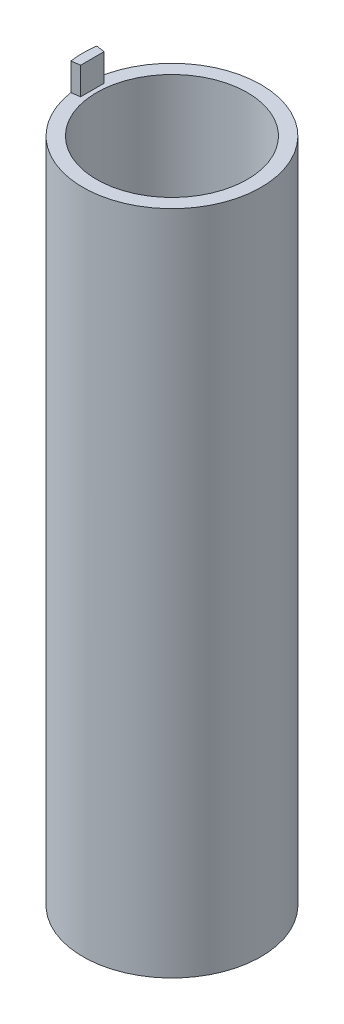
from build123d import *
from build123d.topology import SkipClean

# Parameters (mm, degrees)
SKETCH1_R                = 20.6375
SKETCH1_R_2              = 17.4625
BOSS_EXTRUDE1_DEPTH      = 152.4
BOSS_EXTRUDE2_START      = 2
SKETCH2_R                = 20.6375
BOSS_EXTRUDE2_DEPTH      = 2
SKETCH3_W                = 2
SKETCH3_H                = 6.35
BOSS_EXTRUDE3_REACH      = 166.786
BOSS_EXTRUDE3_END_RADIUS = 18.6375
SKETCH9_W                = 5.421818182
SKETCH9_H                = 6.35


with BuildPart() as part:
    # Sketch1 → Boss-Extrude1 (new body)
    with BuildSketch(Plane(origin=(0, 0, 0), x_dir=(1, 0, 0), z_dir=(0, 1, 0))):
        Circle(SKETCH1_R)
        Circle(SKETCH1_R_2, mode=Mode.SUBTRACT)
    extrude(amount=BOSS_EXTRUDE1_DEPTH)

    # Sketch2 → Boss-Extrude2 (add)
    with BuildSketch(Plane(origin=(0, 0, 0), x_dir=(-1, 0, 0), z_dir=(0, -1, 0)).offset(BOSS_EXTRUDE2_START)):
        Circle(SKETCH2_R)
    extrude(amount=-BOSS_EXTRUDE2_DEPTH)

    # Sweep1: sweep along a path in Sketch4
    with SkipClean():  # the faces are left unmerged after this step: merging them gives an invalid solid
        with BuildLine(Plane(origin=(0, 152.4, 0), x_dir=(1, 0, 0), z_dir=(0, 1, 0))) as sweep1_path:
            ThreePointArc((-17.276785183, -2.54), (-17.4625, 0), (-17.276785183, 2.54))
        # Sketch3 → Sweep1 (sweep)
        with BuildSketch(Plane.XY):
            with Locations((-19.6375, 155.575)):
                Rectangle(SKETCH3_W, SKETCH3_H)
        sweep(path=sweep1_path.line)

    # Boss-Extrude3: up to this cylinder (the profile starts inside it)
    with SkipClean():  # the faces are left unmerged after this step: merging them gives an invalid solid
        boss_extrude3_end = Plane(origin=(0, 155.575, 0), z_dir=(0, 1, 0)) * Cylinder(BOSS_EXTRUDE3_END_RADIUS, 371.847, mode=Mode.PRIVATE)
        # Sketch9 → Boss-Extrude3 (add, up to the surface)
        with BuildSketch(Plane(origin=(-18.439288982, 0, 0), x_dir=(0, 0, -1), z_dir=(1, 0, 0)), mode=Mode.PRIVATE) as boss_extrude3_sk1:
            with Locations((0, 155.575)):
                Rectangle(SKETCH9_W, SKETCH9_H)
        boss_extrude3_tool1 = extrude(boss_extrude3_sk1.sketch, amount=-BOSS_EXTRUDE3_REACH, mode=Mode.PRIVATE) & boss_extrude3_end
        add(boss_extrude3_tool1.solids().sort_by_distance((-18.439289, 155.575, 0))[0])


solid = part.part
